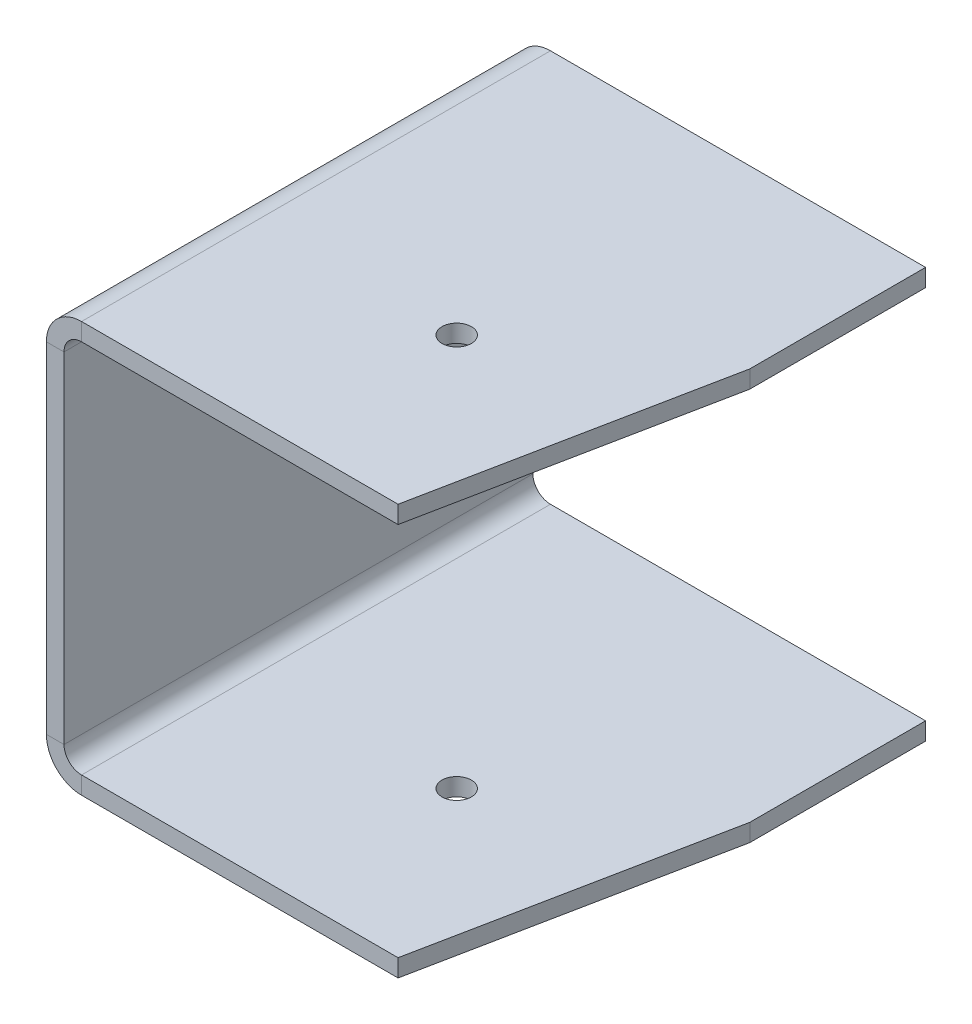
from build123d import *

# Parameters (mm, degrees)
BASE_FLANGE1_DEPTH = 80
CUT_EXTRUDE1_DEPTH = 158
SKETCH7_R          = 2.5
CUT_EXTRUDE2_DEPTH = 158


# Sheet-metal steps are written as plain solids
with BuildPart() as part:
    # Sketch1 → Base-Flange1 (new body)
    with BuildSketch(Plane.XY):
        with BuildLine():
            Line((0, 0), (-64, 0))
            ThreePointArc((-64, 0), (-68.242640687, 1.757359313), (-70, 6))
            Line((-70, 6), (-70, 64))
            ThreePointArc((-70, 64), (-68.242640687, 68.242640687), (-64, 70))
            Line((-64, 70), (0, 70))
            Line((0, 70), (0, 67))
            Line((0, 67), (-64, 67))
            ThreePointArc((-64, 67), (-66.121320344, 66.121320344), (-67, 64))
            Line((-67, 64), (-67, 6))
            ThreePointArc((-67, 6), (-66.121320344, 3.878679656), (-64, 3))
            Line((-64, 3), (0, 3))
            Line((0, 3), (0, 0))
        make_face()
    extrude(amount=BASE_FLANGE1_DEPTH)

    # Sketch6 → Cut-Extrude1 (cut)
    with BuildSketch(Plane.XZ):
        Polygon((0, 80), (-10, 80), (0, 30), align=None)
    extrude(amount=-CUT_EXTRUDE1_DEPTH, mode=Mode.SUBTRACT)

    # Sketch7 → Cut-Extrude2 (cut)
    with BuildSketch(Plane.XZ):
        with Locations(Location((-30, 50, 0), (0, 0, 270))):
            Circle(SKETCH7_R)
    extrude(amount=-CUT_EXTRUDE2_DEPTH, mode=Mode.SUBTRACT)


solid = part.part
